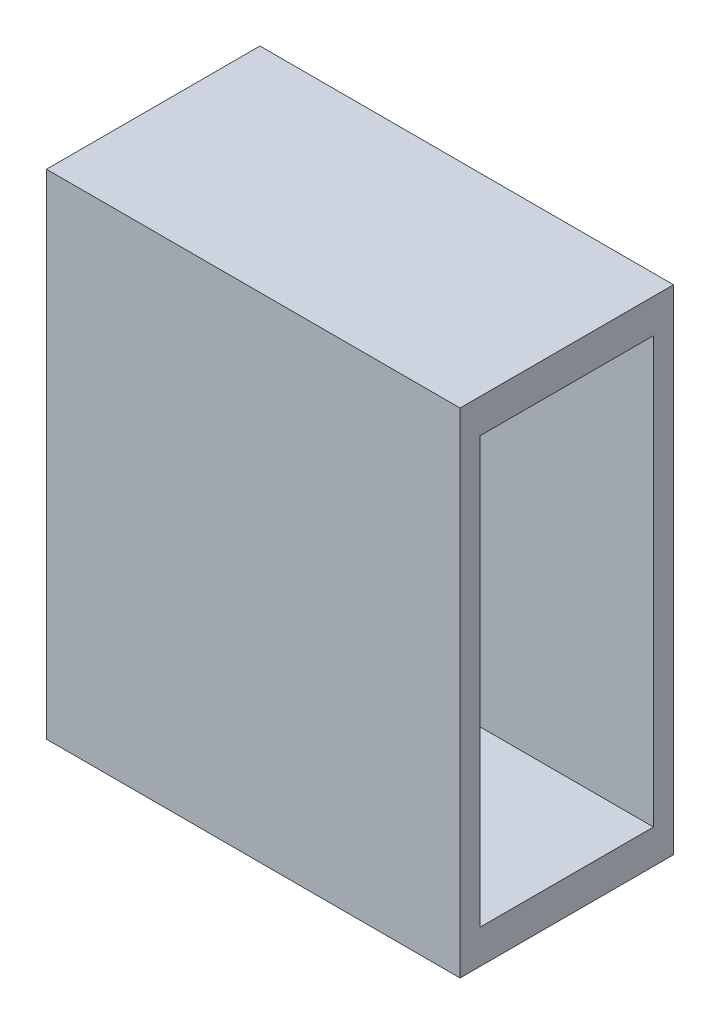
from build123d import *

# Parameters (mm, degrees)
SKETCH1_W           = 37
SKETCH1_H           = 16
BOSS_EXTRUDE1_DEPTH = 26
SKETCH1_3_W         = 4.2
SKETCH1_3_H         = 13
BOSS_EXTRUDE2_DEPTH = 2
SKETCH3_W           = 37
SKETCH3_H           = 16
SKETCH3_W_2         = 31.9
SKETCH3_H_2         = 13
BOSS_EXTRUDE4_DEPTH = 3.5
SKETCH5_W           = 37
SKETCH5_H           = 16
SKETCH5_R           = 5.2
BOSS_EXTRUDE5_DEPTH = 1.5
CUT_EXTRUDE5_DEPTH  = 1.5
SKETCH11_7_R        = 0.15
CUT_EXTRUDE12_DEPTH = 2


with BuildPart() as part:
    # Sketch1 → Boss-Extrude1 (new body)
    with BuildSketch(Plane.YZ):
        with Locations((-18.5, 8)):
            Rectangle(SKETCH1_W, SKETCH1_H)
        Polygon((-34.45, 14.5), (-30.25, 14.5), (-6.75, 14.5), (-2.55, 14.5), (-2.55, 1.5), (-6.75, 1.5), (-30.25, 1.5), (-34.45, 1.5), align=None, mode=Mode.SUBTRACT)
    extrude(amount=BOSS_EXTRUDE1_DEPTH)

    # Sketch1<3> → Boss-Extrude2 (add)
    with BuildSketch(Plane.YZ):
        with Locations((-32.35, 8)):
            Rectangle(SKETCH1_3_W, SKETCH1_3_H)
        with Locations((-4.65, 8)):
            Rectangle(SKETCH1_3_W, SKETCH1_3_H)
    extrude(amount=BOSS_EXTRUDE2_DEPTH)

    # Sketch3 → Boss-Extrude4 (add)
    with BuildSketch(Plane(origin=(0, 0, 0), x_dir=(0, -1, 0), z_dir=(-1, 0, 0))):
        with Locations((18.5, 8)):
            Rectangle(SKETCH3_W, SKETCH3_H)
        with Locations((18.5, 8)):
            Rectangle(SKETCH3_W_2, SKETCH3_H_2, mode=Mode.SUBTRACT)
    extrude(amount=BOSS_EXTRUDE4_DEPTH)

    # Sketch5 → Boss-Extrude5 (add)
    with BuildSketch(Plane(origin=(-3.5, 0, 0), x_dir=(0, -1, 0), z_dir=(-1, 0, 0))):
        with Locations((18.5, 8)):
            Rectangle(SKETCH5_W, SKETCH5_H)
        with Locations((23.25, 8)):
            Circle(SKETCH5_R, mode=Mode.SUBTRACT)
    extrude(amount=BOSS_EXTRUDE5_DEPTH)

    # Sketch11 → Cut-Extrude5 (cut)
    with BuildSketch(Plane.XZ.offset(37)):
        with BuildLine():
            ThreePointArc((18.625, 5.65), (20.975, 8), (18.625, 10.35))
            Line((18.625, 10.35), (3.625, 11.6))
            ThreePointArc((3.625, 11.6), (0.025, 8), (3.625, 4.4))
            Line((3.625, 4.4), (18.625, 5.65))
        make_face()
    extrude(amount=-CUT_EXTRUDE5_DEPTH, mode=Mode.SUBTRACT)

    # Sketch11<7> → Cut-Extrude12 (cut)
    with BuildSketch(Plane.XZ.offset(37)):
        with Locations((3.625, 8)):
            Circle(SKETCH11_7_R)
        with Locations((18.625, 8)):
            Circle(SKETCH11_7_R)
    extrude(amount=-CUT_EXTRUDE12_DEPTH, mode=Mode.SUBTRACT)


solid = part.part
